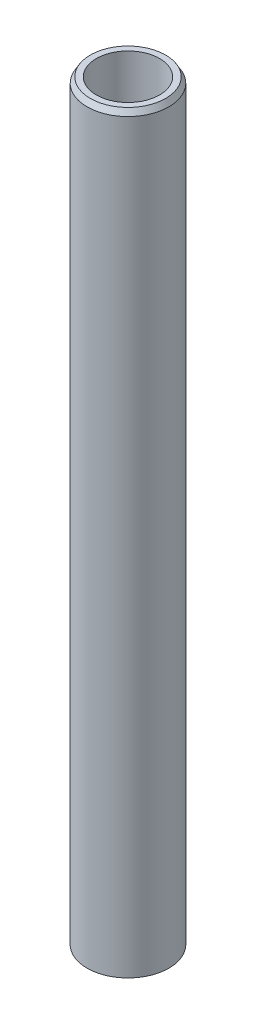
from build123d import *
from OCP.BRepFilletAPI import BRepFilletAPI_MakeChamfer

# Parameters (mm, degrees)
SKETCH1_R           = 32.5
BOSS_EXTRUDE1_DEPTH = 600
SKETCH2_R           = 25.1338512
CUT_EXTRUDE1_DEPTH  = 602.757841661
CHAMFER1_SIZE       = 4.467715583
CHAMFER1_SIZE2      = 2.579436794


with BuildPart() as part:
    # Sketch1 → Boss-Extrude1 (new body)
    with BuildSketch(Plane(origin=(0, 0, 0), x_dir=(1, 0, 0), z_dir=(0, 1, 0))):
        Circle(SKETCH1_R)
    extrude(amount=BOSS_EXTRUDE1_DEPTH)

    # Sketch2 → Cut-Extrude1 (cut, through all)
    with BuildSketch(Plane(origin=(0, 0, 0), x_dir=(1, 0, 0), z_dir=(0, 1, 0))):
        Circle(SKETCH2_R)
    extrude(amount=CUT_EXTRUDE1_DEPTH, mode=Mode.SUBTRACT)

    # Chamfer1: one chamfer whose edges measure the first distance from different faces: ONE call of the kernel's chamfer builder (chamfer() names one face for all edges)
    chamfer1_edges_1 = [part.edges().sort_by_distance(p)[0] for p in [
        (-32.5, 600, 0),
    ]]
    chamfer1_side_1 = [part.faces().sort_by_distance(p)[0] for p in [
        (-32.5, 300, 0),
    ]]
    chamfer1_edges_2 = [part.edges().sort_by_distance(p)[0] for p in [
        (-32.5, 0, 0),
    ]]
    chamfer1_side_2 = [part.faces().sort_by_distance(p)[0] for p in [
        (-31.580761184, 0, 0),
    ]]
    chamfer1 = BRepFilletAPI_MakeChamfer(part.part.solid().wrapped)
    for e in chamfer1_edges_1:
        chamfer1.Add(CHAMFER1_SIZE, CHAMFER1_SIZE2, e.wrapped, chamfer1_side_1[0].wrapped)  # the first distance lies on this face
    for e in chamfer1_edges_2:
        chamfer1.Add(CHAMFER1_SIZE, CHAMFER1_SIZE2, e.wrapped, chamfer1_side_2[0].wrapped)  # the first distance lies on this face
    add(Compound.cast(chamfer1.Shape()), mode=Mode.REPLACE)


solid = part.part
